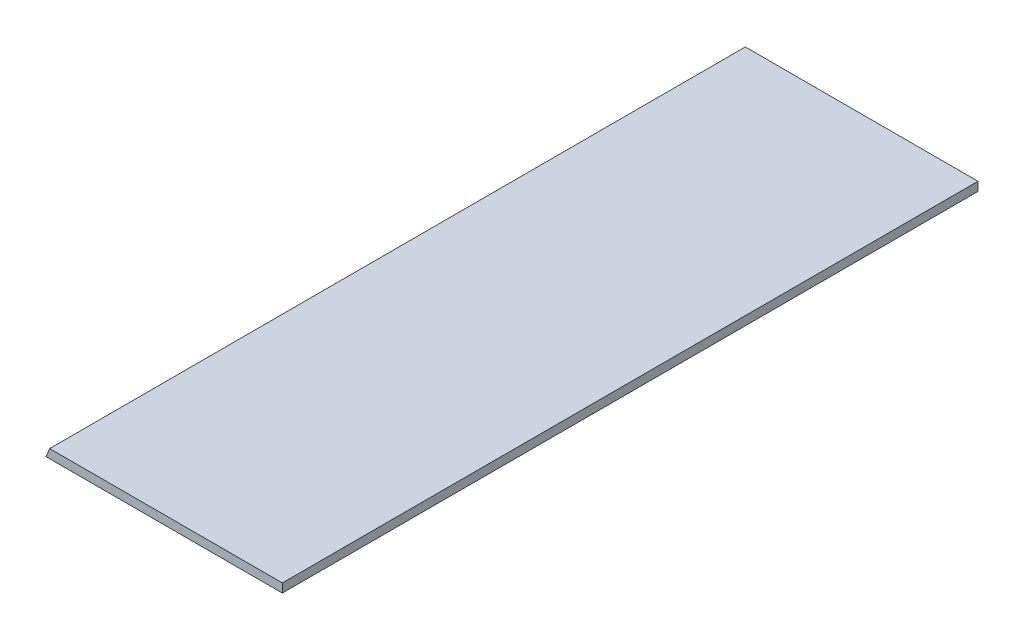
from build123d import *

# Parameters (mm, degrees)
BOSS_EXTRUDE1_DEPTH = 501.65


with BuildPart() as part:
    # Sketch1 → Boss-Extrude1 (new body)
    with BuildSketch(Plane.XY):
        Polygon((0, 0), (2.630256121, 6.35), (170.434, 6.35), (170.434, 0), align=None)
    extrude(amount=BOSS_EXTRUDE1_DEPTH)


solid = part.part
